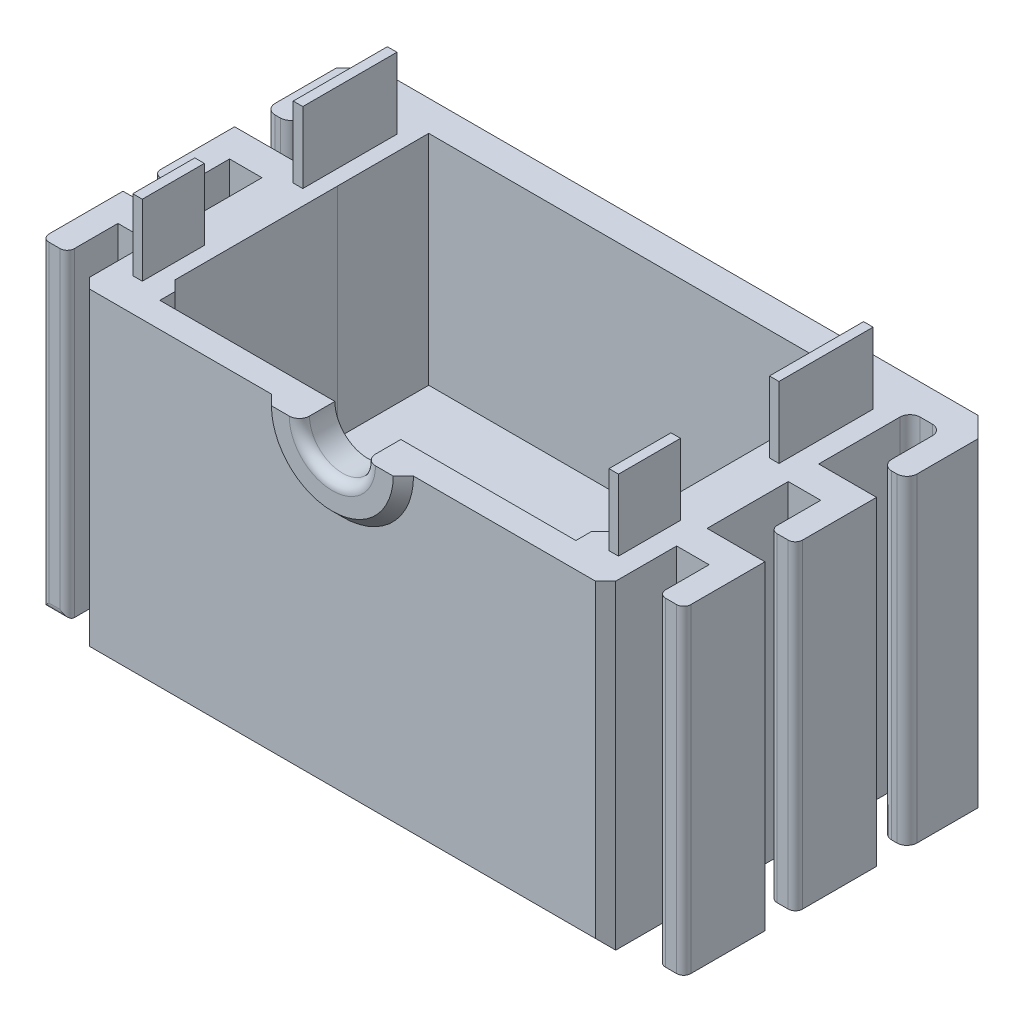
from build123d import *

# Parameters (mm, degrees)
ESQUISSE1_W              = 51.86
ESQUISSE1_H              = 63
BOSS_EXTRU_1_DEPTH       = 20
ENL_V_MAT_EXTRU_1_DEPTH  = 18
ESQUISSE3_W              = 8.7
ESQUISSE3_H              = 3
BOSS_EXTRU_2_DEPTH       = 7
ESQUISSE4_W              = 43
ESQUISSE4_H              = 43
BOSS_EXTRU_3_DEPTH       = 1
CHANFREIN1_SIZE          = 1
ESQUISSE6_R              = 7
BOSS_EXTRU_4_DEPTH       = 5
ENL_V_MAT_EXTRU_2_DEPTH  = 10
BOSS_EXTRU_5_DEPTH       = 63
ESQUISSE9_W              = 2.5
ESQUISSE9_H              = 1
ENL_V_MAT_EXTRU_3_DEPTH  = 63
CHANFREIN3_SIZE          = 1
CONG_1_R                 = 1
CONG_2_R                 = 1
CONG_5_R                 = 0.7
ENL_V_MAT_EXTRU_11_DEPTH = 1.5
ESQUISSE24_W             = 38.565319184
ESQUISSE24_H             = 34.907409987
ENL_V_MAT_EXTRU_16_DEPTH = 74
BOSS_EXTRU_11_REACH      = 71.206
ESQUISSE26_W             = 43.000682915
ESQUISSE26_H             = 8.323167201
ENL_V_MAT_EXTRU_17_DEPTH = 74
ESQUISSE27_W             = 43.00063515
ESQUISSE27_H             = 9
BOSS_EXTRU_12_DEPTH      = 10
BOSS_EXTRU_13_DEPTH      = 1
CHANFREIN4_SIZE          = 1
CHANFREIN5_SIZE          = 1
ESQUISSE29_W             = 0.940494366
ESQUISSE29_H             = 6.11321338
ESQUISSE29_H_2           = 9.278042655
BOSS_EXTRU_14_DEPTH      = 7


with BuildPart() as part:
    # Esquisse1 → Boss.-Extru.1 (new body)
    with BuildSketch(Plane.XY):
        with Locations((25.93, 31.5)):
            Rectangle(ESQUISSE1_W, ESQUISSE1_H)
    extrude(amount=BOSS_EXTRU_1_DEPTH)

    # Esquisse2 → Enlèv. mat.-Extru.1 (cut)
    with BuildSketch(Plane(origin=(0, 0, 0), x_dir=(-1, 0, 0), z_dir=(0, 0, -1))):
        Polygon((-8.231746032, 10), (-43.628253968, 53), (-47.43, 53), (-47.43, 10), align=None)
        Polygon((-4.43, 53), (-43.628253968, 53), (-8.231746032, 10), (-4.43, 10), align=None)
    extrude(amount=-ENL_V_MAT_EXTRU_1_DEPTH, mode=Mode.SUBTRACT)

    # Esquisse3 → Boss.-Extru.2 (add)
    with BuildSketch(Plane(origin=(0, 0, 0), x_dir=(-1, 0, 0), z_dir=(0, 0, -1))):
        with Locations((-8.88, 57.4)):
            Rectangle(ESQUISSE3_W, ESQUISSE3_H)
        with Locations((-42.98, 57.4)):
            Rectangle(ESQUISSE3_W, ESQUISSE3_H)
        with Locations((-42.98, 5.6)):
            Rectangle(ESQUISSE3_W, ESQUISSE3_H)
        with Locations((-8.88, 5.6)):
            Rectangle(ESQUISSE3_W, ESQUISSE3_H)
    extrude(amount=BOSS_EXTRU_2_DEPTH)

    # Esquisse4 → Boss.-Extru.3 (add)
    with BuildSketch(Plane(origin=(0, 0, 18), x_dir=(-1, 0, 0), z_dir=(0, 0, -1))):
        with Locations((-25.93, 31.5)):
            Rectangle(ESQUISSE4_W, ESQUISSE4_H)
    extrude(amount=BOSS_EXTRU_3_DEPTH)

    # Chanfrein1
    chanfrein1_edges = [part.edges().sort_by_distance(p)[0] for p in [
        (47.43, 10, 8.5),
        (47.43, 53, 8.5),
        (4.43, 10, 8.5),
        (4.43, 53, 8.5),
    ]]
    chamfer(chanfrein1_edges, length=CHANFREIN1_SIZE)

    # Esquisse6 → Boss.-Extru.4 (add)
    with BuildSketch(Plane(origin=(0, 0, 17), x_dir=(-1, 0, 0), z_dir=(0, 0, -1))):
        with Locations((-25.93, 31.5)):
            Circle(ESQUISSE6_R)
    extrude(amount=-BOSS_EXTRU_4_DEPTH)

    # Esquisse7 → Enlèv. mat.-Extru.2 (cut)
    with BuildSketch(Plane(origin=(0, 0, 17), x_dir=(-1, 0, 0), z_dir=(0, 0, -1))):
        with BuildLine():
            ThreePointArc((-22.68, 31.5), (-23.631902961, 33.798097039), (-25.93, 34.75))
            Line((-25.93, 34.75), (-25.93, 28.25))
            ThreePointArc((-25.93, 28.25), (-23.631902961, 29.201902961), (-22.68, 31.5))
        make_face()
        with BuildLine():
            Line((-25.93, 28.25), (-25.93, 34.75))
            ThreePointArc((-25.93, 34.75), (-29.18, 31.5), (-25.93, 28.25))
        make_face()
    extrude(amount=-ENL_V_MAT_EXTRU_2_DEPTH, mode=Mode.SUBTRACT)

    # Esquisse8 → Boss.-Extru.5 (add)
    with BuildSketch(Plane(origin=(0, 63, 0), x_dir=(1, 0, 0), z_dir=(0, 1, 0))):
        Polygon((55.06, -3), (55.06, -9), (57.56, -9), (57.56, 0), (51.86, 0), (51.86, -3), align=None)
        Polygon((57.56, -11), (51.86, -11), (51.86, -14), (55.06, -14), (55.06, -20), (57.56, -20), align=None)
        Polygon((0, -3), (0, 0), (-5.7, 0), (-5.7, -9), (-3.2, -9), (-3.2, -3), align=None)
        Polygon((0, -14), (0, -11), (-5.7, -11), (-5.7, -20), (-3.2, -20), (-3.2, -14), align=None)
    extrude(amount=-BOSS_EXTRU_5_DEPTH)

    # Esquisse9 → Enlèv. mat.-Extru.3 (cut)
    with BuildSketch(Plane.XZ):
        with Locations((-4.45, 8.5)):
            Rectangle(ESQUISSE9_W, ESQUISSE9_H)
        with Locations((-4.45, 19.5)):
            Rectangle(ESQUISSE9_W, ESQUISSE9_H)
        with Locations((56.31, 8.5)):
            Rectangle(ESQUISSE9_W, ESQUISSE9_H)
        with Locations((56.31, 19.5)):
            Rectangle(ESQUISSE9_W, ESQUISSE9_H)
    extrude(amount=-ENL_V_MAT_EXTRU_3_DEPTH, mode=Mode.SUBTRACT)

    # Chanfrein3
    chanfrein3_edges = [part.edges().sort_by_distance(p)[0] for p in [
        (46.93, 52.5, 17),
        (4.93, 52.5, 17),
        (46.93, 10.5, 17),
        (4.93, 10.5, 17),
        (25.93, 34.75, 17),
        (4.43, 31.5, 17),
        (25.93, 10, 17),
        (47.43, 31.5, 17),
        (25.93, 53, 17),
    ]]
    chamfer(chanfrein3_edges, length=CHANFREIN3_SIZE)

    # Congé1
    cong_1_edges = [part.edges().sort_by_distance(p)[0] for p in [
        (4.53, 57.4, -7),
        (8.88, 55.9, -7),
        (8.88, 58.9, -7),
        (13.23, 57.4, -7),
        (38.63, 57.4, -7),
        (42.98, 58.9, -7),
        (47.33, 57.4, -7),
        (42.98, 55.9, -7),
        (47.33, 5.6, -7),
        (42.98, 7.1, -7),
        (42.98, 4.1, -7),
        (38.63, 5.6, -7),
        (13.23, 5.6, -7),
        (8.88, 4.1, -7),
        (4.53, 5.6, -7),
        (8.88, 7.1, -7),
    ]]
    fillet(cong_1_edges, radius=CONG_1_R)

    # Congé2
    cong_2_edges = [part.edges().sort_by_distance(p)[0] for p in [
        (25.93, 34.75, 22),
    ]]
    fillet(cong_2_edges, radius=CONG_2_R)

    # Congé5
    cong_5_edges = [part.edges().sort_by_distance(p)[0] for p in [
        (-3.2, 31.5, 19),
        (-5.7, 31.5, 19),
        (-3.2, 31.5, 8),
        (-5.7, 31.5, 8),
        (55.06, 31.5, 8),
        (57.56, 31.5, 8),
        (55.06, 31.5, 19),
        (57.56, 31.5, 19),
        (-4.45, 0, 19),
        (-4.45, 63, 19),
    ]]
    fillet(cong_5_edges, radius=CONG_5_R)

    # Esquisse19 → Enlèv. mat.-Extru.11 (cut)
    with BuildSketch(Plane(origin=(0, 0, 17), x_dir=(-1, 0, 0), z_dir=(0, 0, -1))):
        Polygon((-46.43, 11.414213562), (-46.015786438, 11), (-5.844213562, 11), (-5.43, 11.414213562), (-5.43, 51.585786438), (-5.844213562, 52), (-46.015786438, 52), (-46.43, 51.585786438), align=None)
    extrude(amount=-ENL_V_MAT_EXTRU_11_DEPTH, mode=Mode.SUBTRACT)

    # Esquisse24 → Enlèv. mat.-Extru.16 (cut)
    with BuildSketch(Plane(origin=(57.56, 0, 0), x_dir=(0, 0, -1), z_dir=(1, 0, 0))):
        with Locations((-11.348740569, 48.953704994)):
            Rectangle(ESQUISSE24_W, ESQUISSE24_H)
    extrude(amount=-ENL_V_MAT_EXTRU_16_DEPTH, mode=Mode.SUBTRACT)

    # Boss.-Extru.11: up to this face of the body (flat: up to its plane)
    boss_extru_11_end = Plane(part.part.faces().sort_by_distance((25.97056106, 0, 9.851467598))[0])
    # Esquisse25 → Boss.-Extru.11 (add, up to the picked face)
    with BuildSketch(Plane(origin=(0, 31.5, 0), x_dir=(1, 0, 0), z_dir=(0, 1, 0)), mode=Mode.PRIVATE) as boss_extru_11_sk1:
        with BuildLine():
            Line((47.42936485, 9), (47.43, 0))
            Line((47.43, 0), (51.86, 0))
            Line((51.86, 0), (51.86, 8))
            ThreePointArc((51.86, 8), (52.152893219, 8.707106781), (52.86, 9))
            Line((52.86, 9), (54.06, 9))
            ThreePointArc((54.06, 9), (54.767106781, 8.707106781), (55.06, 8))
            Line((55.06, 8), (55.06, 4))
            ThreePointArc((55.06, 4), (55.352893219, 3.292893219), (56.06, 3))
            Line((56.06, 3), (56.56, 3))
            ThreePointArc((56.56, 3), (57.267106781, 3.292893219), (57.56, 4))
            Line((57.56, 4), (57.56, 10))
            Line((57.56, 10), (55.56, 12))
            Line((55.56, 12), (25.92936485, 12))
            Line((25.92936485, 12), (25.92936485, 9))
            Line((25.92936485, 9), (47.42936485, 9))
        make_face()
    boss_extru_11_tool1 = split(extrude(boss_extru_11_sk1.sketch, amount=-BOSS_EXTRU_11_REACH, mode=Mode.PRIVATE), bisect_by=boss_extru_11_end, keep=Keep.BOTH, mode=Mode.PRIVATE)
    # Esquisse25 → Boss.-Extru.11 (add, up to the picked face)
    with BuildSketch(Plane(origin=(0, 31.5, 0), x_dir=(1, 0, 0), z_dir=(0, 1, 0)), mode=Mode.PRIVATE) as boss_extru_11_sk2:
        with BuildLine():
            Line((4.42936485, 9), (25.92936485, 9))
            Line((25.92936485, 9), (25.92936485, 12))
            Line((25.92936485, 12), (-3.7012703, 12))
            Line((-3.7012703, 12), (-5.7012703, 10))
            Line((-5.7012703, 10), (-5.7012703, 4))
            ThreePointArc((-5.7012703, 4), (-5.408377081, 3.292893219), (-4.7012703, 3))
            Line((-4.7012703, 3), (-4.2012703, 3))
            ThreePointArc((-4.2012703, 3), (-3.494163519, 3.292893219), (-3.2012703, 4))
            Line((-3.2012703, 4), (-3.2012703, 8))
            ThreePointArc((-3.2012703, 8), (-2.908377081, 8.707106781), (-2.2012703, 9))
            Line((-2.2012703, 9), (-1.0012703, 9))
            ThreePointArc((-1.0012703, 9), (-0.294163519, 8.707106781), (-0.0012703, 8))
            Line((-0.0012703, 8), (-0.0012703, 0))
            Line((-0.0012703, 0), (4.4287297, 0))
            Line((4.4287297, 0), (4.42936485, 9))
        make_face()
    boss_extru_11_tool2 = split(extrude(boss_extru_11_sk2.sketch, amount=-BOSS_EXTRU_11_REACH, mode=Mode.PRIVATE), bisect_by=boss_extru_11_end, keep=Keep.BOTH, mode=Mode.PRIVATE)
    add(boss_extru_11_tool1.solids().sort_by(Axis((36.679365, 31.5, -9.338304), (0, -1, 0)))[0])
    add(boss_extru_11_tool2.solids().sort_by(Axis((15.179365, 31.5, -9.338304), (0, -1, 0)))[0])

    # Esquisse26 → Enlèv. mat.-Extru.17 (cut)
    with BuildSketch(Plane.XZ.offset(-4.1)):
        with Locations((25.929658543, -4.161583601)):
            Rectangle(ESQUISSE26_W, ESQUISSE26_H)
    extrude(amount=-ENL_V_MAT_EXTRU_17_DEPTH, mode=Mode.SUBTRACT)

    # Esquisse27 → Boss.-Extru.12 (add)
    with BuildSketch(Plane.XZ):
        with Locations((25.929682425, -4.5)):
            Rectangle(ESQUISSE27_W, ESQUISSE27_H)
    extrude(amount=-BOSS_EXTRU_12_DEPTH)

    # Esquisse28 → Boss.-Extru.13 (add)
    with BuildSketch(Plane.XY.offset(20)):
        with BuildLine():
            Line((51.86, 0), (51.86, 31.5))
            Line((51.86, 31.5), (32.93, 31.5))
            ThreePointArc((32.93, 31.5), (25.93, 24.5), (18.93, 31.5))
            Line((18.93, 31.5), (0, 31.5))
            Line((0, 31.5), (0, 0))
            Line((0, 0), (51.86, 0))
        make_face()
    extrude(amount=BOSS_EXTRU_13_DEPTH)

    # Chanfrein4
    chanfrein4_edges = [part.edges().sort_by_distance(p)[0] for p in [
        (25.93, 24.5, 22),
    ]]
    chamfer(chanfrein4_edges, length=CHANFREIN4_SIZE - 0.0001)  # a hair under: the kernel refuses the full size

    # Chanfrein5
    chanfrein5_edges = [part.edges().sort_by_distance(p)[0] for p in [
        (25.92936485, 0, -12),
        (25.93, 0, 21),
        (51.86, 15.75, 21),
        (0, 15.75, 21),
    ]]
    chamfer(chanfrein5_edges, length=CHANFREIN5_SIZE)

    # Esquisse29 → Boss.-Extru.14 (add)
    with BuildSketch(Plane(origin=(0, 31.5, 0), x_dir=(1, 0, 0), z_dir=(0, 1, 0))):
        with Locations((2.465352228, -14.677342748)):
            Rectangle(ESQUISSE29_W, ESQUISSE29_H)
        with Locations((2.465352228, 2.720621555)):
            Rectangle(ESQUISSE29_W, ESQUISSE29_H_2)
        with Locations((49.394647772, 2.720621555)):
            Rectangle(ESQUISSE29_W, ESQUISSE29_H_2)
        with Locations((49.394647772, -14.677342748)):
            Rectangle(ESQUISSE29_W, ESQUISSE29_H)
    extrude(amount=BOSS_EXTRU_14_DEPTH)


solid = part.part
